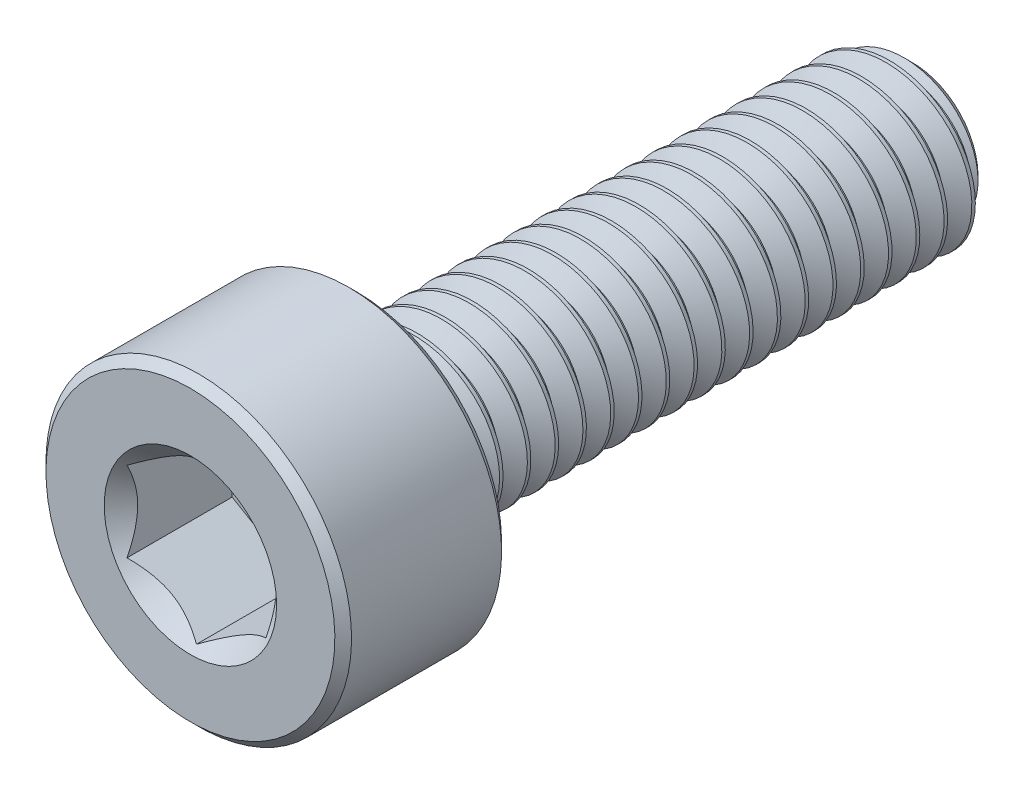
from build123d import *

# Parameters (mm, degrees)
CUT_EXTRUDE1_DEPTH     = 2
SKETCH4_R              = 1.551628848
CUT_EXTRUDE2_DEPTH     = 1.5
CUT_EXTRUDE2_DRAFT     = -45
SPLIT1_SURFACE_1_BACK  = 16.149
SPLIT1_SURFACE_1_DEPTH = 32.298
SPLIT1_SURFACE_2_BACK  = 16.149
SPLIT1_SURFACE_2_DEPTH = 32.298
CUT_SWEEP1_PITCH       = 0.5


with BuildPart() as part:
    # Sketch2 → Revolve1 (revolve)
    with BuildSketch(Plane(origin=(0, 0, 0), x_dir=(0, 0, -1), z_dir=(1, 0, 0))):
        with BuildLine():
            Line((-6.5, 0), (-6.5, 2.6))
            Line((-6.5, 2.6), (-6.35, 2.75))
            Line((-6.35, 2.75), (-3.65, 2.75))
            Line((-3.65, 2.75), (-3.5, 2.6))
            Line((-3.5, 2.6), (-3.5, 1.65))
            ThreePointArc((-3.5, 1.65), (-3.456066017, 1.543933983), (-3.35, 1.5))
            Line((-3.35, 1.5), (6.175240474, 1.5))
            Line((6.175240474, 1.5), (6.5, 1.175240474))
            Line((6.5, 1.175240474), (6.5, 0))
            Line((6.5, 0), (-6.5, 0))
        make_face()
    revolve(axis=Axis((0, 0, -6.5), (0, 0, 1)))

    # Sketch3 → Cut-Extrude1 (cut)
    with BuildSketch(Plane.XY.offset(6.5)):
        Polygon((1.25, -0.721687836), (1.25, 0.721687836), (0, 1.443375673), (-1.25, 0.721687836), (-1.25, -0.721687836), (0, -1.443375673), align=None)
    extrude(amount=-CUT_EXTRUDE1_DEPTH, mode=Mode.SUBTRACT)


with BuildPart() as cut_extrude2_tool:
    # Sketch4 → Cut-Extrude2 (with draft: the straight prism first)
    with BuildSketch(Plane.XY.offset(6.5)):
        Circle(SKETCH4_R)
    extrude(amount=-CUT_EXTRUDE2_DEPTH)
    # Cut-Extrude2: the draft: its side faces are tilted about the plane it starts from
    cut_extrude2_sides = [cut_extrude2_tool.faces().sort_by_distance(p)[0] for p in [
        (-1.551628848, 0, 5.75),
    ]]
    draft(cut_extrude2_sides, Plane.XY.offset(6.5), CUT_EXTRUDE2_DRAFT)


with BuildPart() as part_1:
    add(part.part)

    # Cut-Extrude2: cut by cut_extrude2_tool
    add(cut_extrude2_tool.part, mode=Mode.SUBTRACT)


with BuildPart() as body_2:
    # Split1: the piece behind the surface
    add(part_1.part)
    # Split1 surface: a surface, the sketch's curves swept straight by 32.298 mm
    with BuildLine(Plane(origin=(0, 0, 0), x_dir=(0, 0, -1), z_dir=(1, 0, 0)).offset(-SPLIT1_SURFACE_1_BACK), mode=Mode.PRIVATE) as split1_surface_1_path:
        Line((-3.35, -2.75), (-3.35, 2.75))
    split1_surface_1 = Shell.extrude(split1_surface_1_path.wire(), (1 * SPLIT1_SURFACE_1_DEPTH, 0 * SPLIT1_SURFACE_1_DEPTH, 0 * SPLIT1_SURFACE_1_DEPTH))
    split(bisect_by=split1_surface_1, keep=Keep.BOTTOM)

    # Cut-Sweep1: the profile of Sketch7 screwed along a right-hand helix of 21 turns, 6 arcs to a turn; built about Z, then put on its axis
    cut_sweep1_z = Axis((0, 0, 0), (0, 0, 1))
    cut_sweep1_corners = [(1.527063294, 0, 0.015625), (1.527063294, 0, -0.453125), (1.175240474, 0, -0.25), (1.175240474, 0, -0.1875)]
    with BuildLine(mode=Mode.PRIVATE) as cut_sweep1_profile:
        Line(cut_sweep1_corners[0], cut_sweep1_corners[1])
        Line(cut_sweep1_corners[1], cut_sweep1_corners[2])
        Line(cut_sweep1_corners[2], cut_sweep1_corners[3])
        Line(cut_sweep1_corners[3], cut_sweep1_corners[0])
    cut_sweep1_cap = Face(cut_sweep1_profile.wire())
    cut_sweep1_turn_angles = [0, 30, 60, 90, 120, 150, 180, 210, 240, 270, 300, 330, 360]
    cut_sweep1_turn_weights = [1, 0.8660254037844387, 1, 0.8660254037844387, 1, 0.8660254037844387, 1, 0.8660254037844387, 1, 0.8660254037844387, 1, 0.8660254037844387, 1]
    cut_sweep1_turn_rails = [Edge.make_bspline([Vector(p[0], p[1], 0).rotate(cut_sweep1_z, cut_sweep1_turn_angles[k]) / cut_sweep1_turn_weights[k] + Vector(0, 0, p[2] + CUT_SWEEP1_PITCH * cut_sweep1_turn_angles[k] / 360) for k in range(13)], [0, 0, 0, 1, 1, 2, 2, 3, 3, 4, 4, 5, 5, 6, 6, 6], 2, cut_sweep1_turn_weights) for p in cut_sweep1_corners]
    cut_sweep1_turn_sides = [Face.make_surface_from_curves(cut_sweep1_turn_rails[p[0]], cut_sweep1_turn_rails[p[1]]) for p in [(0, 1), (1, 2), (2, 3), (3, 0)]]
    cut_sweep1 = Plane(origin=(0, 0, -6.5), x_dir=(0, 1, 0), z_dir=(0, 0, 1)) * Solid(Shell([*[p.moved(Location((0, 0, CUT_SWEEP1_PITCH * i))) for i in range(21) for p in cut_sweep1_turn_sides], cut_sweep1_cap, cut_sweep1_cap.rotate(cut_sweep1_z, 7560).moved(Location((0, 0, CUT_SWEEP1_PITCH * 7560 / 360)))]))
    add(cut_sweep1, mode=Mode.SUBTRACT)


with BuildPart() as part_2:
    add(part_1.part)

    # Split1: split by a surface, the side it looks to stays
    # Split1 surface: a surface, the sketch's curves swept straight by 32.298 mm
    with BuildLine(Plane(origin=(0, 0, 0), x_dir=(0, 0, -1), z_dir=(1, 0, 0)).offset(-SPLIT1_SURFACE_2_BACK), mode=Mode.PRIVATE) as split1_surface_2_path:
        Line((-3.35, -2.75), (-3.35, 2.75))
    split1_surface_2 = Shell.extrude(split1_surface_2_path.wire(), (1 * SPLIT1_SURFACE_2_DEPTH, 0 * SPLIT1_SURFACE_2_DEPTH, 0 * SPLIT1_SURFACE_2_DEPTH))
    split(bisect_by=split1_surface_2, keep=Keep.TOP)

    add(body_2.part)  # Revolve2 merges body 2
    # Sketch8 → Revolve2 (revolve)
    with BuildSketch(Plane(origin=(0, 0, 0), x_dir=(0, 0, -1), z_dir=(1, 0, 0))):
        Polygon((-3.5, 0), (-3.5, 1.5), (-3.35, 1.5), (-2.483974596, 0), align=None)
    revolve(axis=Axis((0, 0, 2.483974596), (0, 0, 1)))


solid = part_2.part
